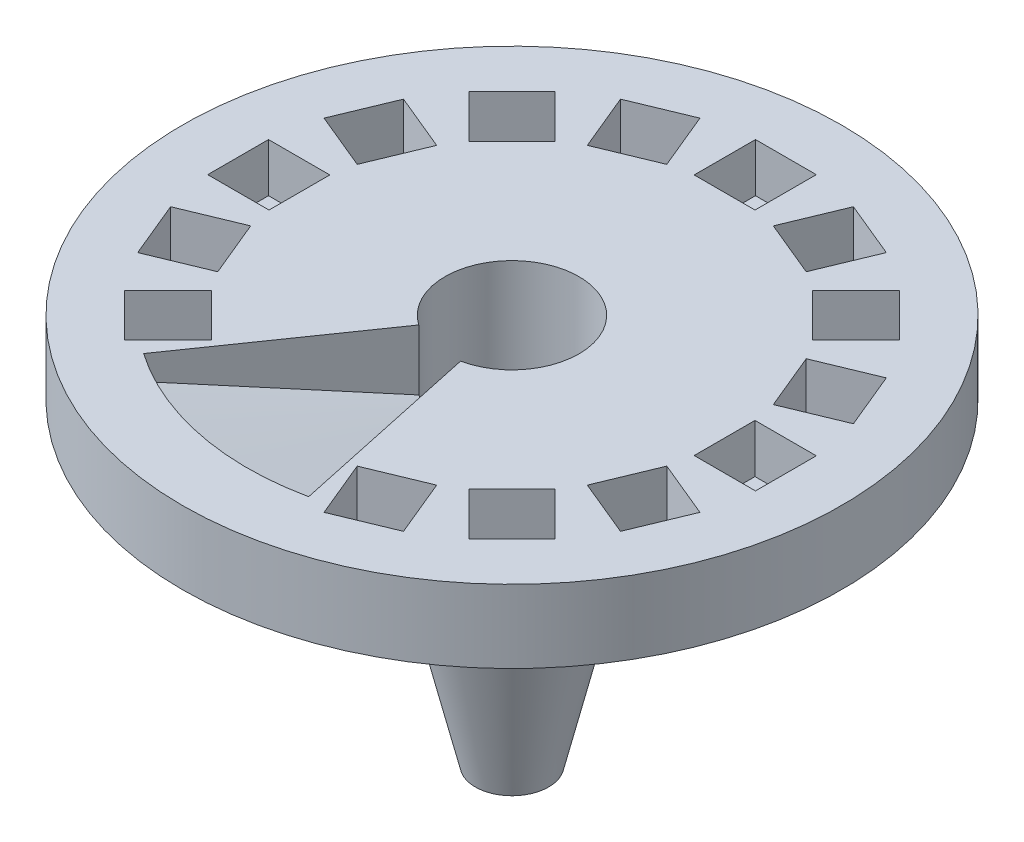
from build123d import *

# Parameters (mm, degrees)
SKETCH3_W          = 12.5
SKETCH3_H          = 12.6
CUT_EXTRUDE1_DEPTH = 10
CIRPATTERN1_COUNT  = 16
CUT_SWEEP3_ANGLE   = 46.890766


# Read off the part's stored shape, not the designer's step: Cut-Sweep3
with BuildPart() as part:
    # Sketch1 → Revolve1 (revolve)
    with BuildSketch(Plane(origin=(0, 0, 0), x_dir=(0, 0, -1), z_dir=(1, 0, 0))):
        Polygon((13.767922605, 0), (67.742922605, 0), (67.742922605, -15), (16.605833346, -15), (16.605833346, -42.092408241), (7.539548782, -80.219585538), (2.539548782, -80.219585538), (13.767922605, -33), align=None)
    revolve(axis=Axis((0, 0, 0), (0, 1, 0)))

    # Sketch3 → Cut-Extrude1 (cut)
    with BuildSketch(Plane(origin=(0, 0, 0), x_dir=(1, 0, 0), z_dir=(0, 1, 0))):
        with Locations((0, 50)):
            Rectangle(SKETCH3_W, SKETCH3_H)
    cut_extrude1 = extrude(amount=-CUT_EXTRUDE1_DEPTH, mode=Mode.SUBTRACT)

    # CirPattern1: Cut-Extrude1 ×16 about axis, 2 skipped
    cirpattern1_axis = Axis((0, 0, 0), (0, -1, 0))
    add([cut_extrude1.rotate(cirpattern1_axis, i * 360 / CIRPATTERN1_COUNT) for i in range(1, CIRPATTERN1_COUNT) if i not in (8, 9)], mode=Mode.SUBTRACT)

    # Cut-Sweep3 outline → Cut-Sweep3 (revolve, cut)
    with BuildSketch(Plane(origin=(0, 0, 0), x_dir=(-0.5705578043075069, 0, 0.8212574455941308), z_dir=(-0.8212574455941308, 0, -0.5705578043075069))):
        Polygon((54.406189133, -5), (54.406189133, 0), (13.767922605, 0), (13.767922605, -12.46941978), align=None)
    revolve(axis=Axis((0, 0, 0), (0, 1, 0)), revolution_arc=CUT_SWEEP3_ANGLE, mode=Mode.SUBTRACT)


solid = part.part
